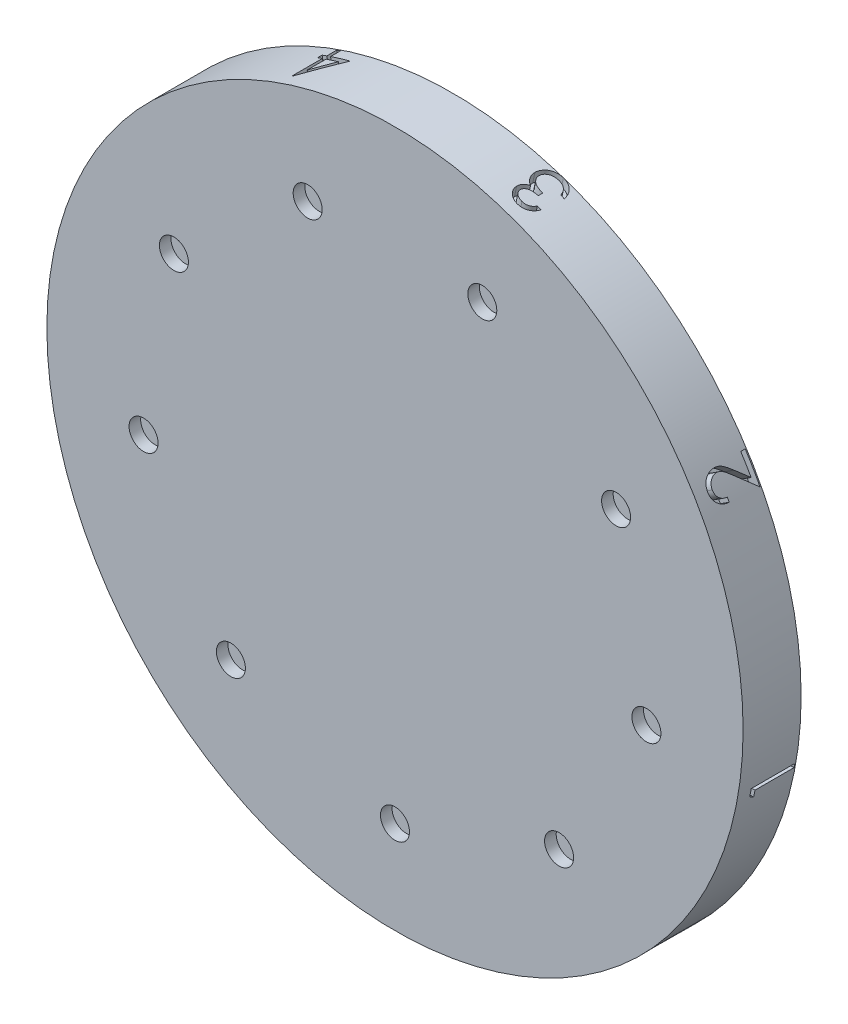
from build123d import *

# Parameters (mm, degrees)
SKETCH1_R           = 76.2
BOSS_EXTRUDE1_DEPTH = 12.7
SKETCH2_R           = 3.175
CUT_EXTRUDE2_DEPTH  = 2.54
SKETCH4_R           = 6.35
CUT_EXTRUDE4_DEPTH  = 5.08
CUT_EXTRUDE5_DEPTH  = 2.54
CUT_EXTRUDE6_DEPTH  = 2.54
CUT_EXTRUDE7_DEPTH  = 2.54
CUT_EXTRUDE8_DEPTH  = 2.54
CUT_EXTRUDE9_DEPTH  = 2.54
CUT_EXTRUDE10_DEPTH = 2.54
CUT_EXTRUDE11_DEPTH = 2.54
CUT_EXTRUDE12_DEPTH = 2.54
CUT_EXTRUDE13_DEPTH = 2.54


with BuildPart() as part:
    # Sketch1 → Boss-Extrude1 (new body)
    with BuildSketch(Plane.XY):
        Circle(SKETCH1_R)
    extrude(amount=BOSS_EXTRUDE1_DEPTH)

    # Sketch2 → Cut-Extrude2 (cut)
    with BuildSketch(Plane.XY.offset(12.7)):
        with Locations((0, -55.88)):
            Circle(SKETCH2_R)
        with Locations((-35.918971629, -42.806563481)):
            Circle(SKETCH2_R)
        with Locations((-55.031057238, -9.703460168)):
            Circle(SKETCH2_R)
        with Locations((-48.393499563, 27.94)):
            Circle(SKETCH2_R)
        with Locations((-19.112085609, 52.51002365)):
            Circle(SKETCH2_R)
        with Locations((19.112085609, 52.51002365)):
            Circle(SKETCH2_R)
        with Locations((48.393499563, 27.94)):
            Circle(SKETCH2_R)
        with Locations((55.031057238, -9.703460168)):
            Circle(SKETCH2_R)
        with Locations((35.918971629, -42.806563481)):
            Circle(SKETCH2_R)
    extrude(amount=-CUT_EXTRUDE2_DEPTH, mode=Mode.SUBTRACT)

    # Sketch4 → Cut-Extrude4 (cut)
    with BuildSketch(Plane(origin=(0, 0, 0), x_dir=(-1, 0, 0), z_dir=(0, 0, -1))):
        Circle(SKETCH4_R)
    extrude(amount=-CUT_EXTRUDE4_DEPTH, mode=Mode.SUBTRACT)

    # Sketch5 → Cut-Extrude5 (cut)
    with BuildSketch(Plane(origin=(76.2, 0, 0), x_dir=(0, 0, -1), z_dir=(1, 0, 0))):
        Polygon((-9.779, -14.958355629), (-9.779, -13.197222817), (-0.254, -13.197222817), (-0.254, -14.052030509), (-8.802076923, -14.052030509), (-8.802076923, -15.517415125), align=None)
    extrude(amount=-CUT_EXTRUDE5_DEPTH, mode=Mode.SUBTRACT)

    # Sketch9 → Cut-Extrude6 (cut)
    with BuildSketch(Plane(origin=(64.070307616, 41.248462783, 0), x_dir=(0.5413184092295229, -0.8408176852500302, 0), z_dir=(0.8408176852500302, 0.5413184092295229, 0))):
        with BuildLine():
            Line((5.512499921, -6.848230769), (6.367307613, -6.848230769))
            add(Edge.make_bspline(
                [(6.367307613, -6.848230769), (6.361737381, -6.961635673), (6.350797593, -7.184359885), (6.29954433, -7.509083464), (6.226275221, -7.819504079), (6.122435799, -8.112960447), (5.994203188, -8.392958148), (5.837209363, -8.655779138), (5.654801178, -8.904031883), (5.447313268, -9.133016136), (5.222169763, -9.342336373), (4.980719623, -9.525007952), (4.725444498, -9.677581719), (4.458558535, -9.805823488), (4.17697512, -9.901967628), (3.883385876, -9.973336337), (3.576463808, -10.016268246), (3.367349412, -10.020883522), (3.260997517, -10.023230769)],
                knots=[0, 0, 0, 0, 1.100776268, 2.161895295, 3.184016182, 4.190939212, 5.176500551, 6.166955529, 7.155448256, 8.160289653, 9.16017456, 10.133824356, 11.091467644, 12.04088621, 13.000931625, 13.972173743, 14.968683325, 16, 16, 16, 16], degree=3))
            add(Edge.make_bspline(
                [(3.260997517, -10.023230769), (3.15654698, -10.020805526), (2.951305405, -10.01604001), (2.651883472, -9.974499656), (2.366163138, -9.910842765), (2.097382469, -9.81651328), (1.842783018, -9.698150411), (1.605517151, -9.550950676), (1.379847531, -9.381879071), (1.176849629, -9.182450822), (0.990371568, -8.969660377), (0.829638753, -8.742401971), (0.691214389, -8.507409781), (0.57791837, -8.262848177), (0.49203495, -8.007920747), (0.428403566, -7.745071568), (0.392028428, -7.471267183), (0.386476437, -7.285914725), (0.383653767, -7.191680288)],
                knots=[0, 0, 0, 0, 1.111674182, 2.184400057, 3.212814286, 4.223731311, 5.211378316, 6.196328225, 7.191884489, 8.207283132, 9.220262353, 10.201199469, 11.166417575, 12.120932471, 13.06540007, 14.026332106, 14.996573967, 16, 16, 16, 16], degree=3))
            add(Edge.make_bspline(
                [(0.383653767, -7.191680288), (0.388261934, -7.059016596), (0.397397399, -6.79601727), (0.475540463, -6.409533128), (0.597591079, -6.035085653), (0.744528006, -5.733711723), (0.89280002, -5.490892134), (1.026280993, -5.290867771), (1.183431222, -5.075551985), (1.362908086, -4.844073288), (1.567802431, -4.599463088), (1.792791129, -4.336730681), (2.043684591, -4.060734169), (2.219621225, -3.872102024), (2.310787181, -3.774357572)],
                knots=[0, 0, 0, 0, 1.184416499, 2.348048165, 3.509039915, 4.696071444, 5.333504901, 6.05069495, 6.844171097, 7.714965912, 8.667477798, 9.695072654, 10.805644396, 12, 12, 12, 12], degree=3))
            Line((2.310787181, -3.774357572), (4.693945234, -1.230923077))
            Line((4.693945234, -1.230923077), (0.261538383, -1.230923077))
            Line((0.261538383, -1.230923077), (0.261538383, -0.254))
            Line((0.261538383, -0.254), (6.733653767, -0.254))
            Line((6.733653767, -0.254), (3.039663383, -4.19603726))
            add(Edge.make_bspline(
                [(3.039663383, -4.19603726), (2.949719552, -4.289916816), (2.77695586, -4.470240231), (2.532702764, -4.733586657), (2.31297133, -4.977609906), (2.117615799, -5.203391305), (1.946475432, -5.409650884), (1.800097804, -5.598005051), (1.67783595, -5.766837404), (1.548263863, -5.965174594), (1.424708281, -6.207619944), (1.316115566, -6.502410515), (1.250375013, -6.806545379), (1.242448542, -7.012008475), (1.238461459, -7.115358173)],
                knots=[0, 0, 0, 0, 1.329530082, 2.553755191, 3.672934919, 4.687409497, 5.60679272, 6.413407421, 7.126401618, 7.737995624, 8.834647426, 9.90044882, 10.943907757, 12, 12, 12, 12], degree=3))
            add(Edge.make_bspline(
                [(1.238461459, -7.115358173), (1.240173815, -7.180356875), (1.243548539, -7.308456835), (1.273896266, -7.496148032), (1.318483101, -7.677900083), (1.387205188, -7.851465755), (1.469772244, -8.020258747), (1.575257748, -8.179147228), (1.695799977, -8.333547323), (1.835623052, -8.478164782), (1.989122806, -8.610656831), (2.151309567, -8.728013435), (2.322894548, -8.826091957), (2.503162677, -8.906492299), (2.691609176, -8.969562491), (2.888599116, -9.013264755), (3.093588039, -9.040703519), (3.233560625, -9.044416014), (3.304882734, -9.046307692)],
                knots=[0, 0, 0, 0, 0.991504627, 1.954065223, 2.895985987, 3.842598665, 4.797835564, 5.759220273, 6.74786863, 7.784730864, 8.824135544, 9.839918996, 10.835834653, 11.835434876, 12.84861661, 13.863796685, 14.911511676, 16, 16, 16, 16], degree=3))
            add(Edge.make_bspline(
                [(3.304882734, -9.046307692), (3.379389527, -9.044439156), (3.525708567, -9.040769659), (3.740075671, -9.012957907), (3.946006227, -8.970838427), (4.140326902, -8.903784559), (4.327104482, -8.825306767), (4.501574178, -8.723691831), (4.668637061, -8.607581052), (4.824934281, -8.472203259), (4.967287275, -8.319382121), (5.096787068, -8.153039013), (5.206513526, -7.970225009), (5.303916596, -7.775326783), (5.378410714, -7.562989677), (5.442097847, -7.338406654), (5.488359256, -7.098373441), (5.504319382, -6.932996532), (5.512499921, -6.848230769)],
                knots=[0, 0, 0, 0, 1.031072318, 2.024855787, 2.988461151, 3.935103592, 4.865765533, 5.788564469, 6.724086513, 7.67908574, 8.64457978, 9.611397706, 10.591395687, 11.591555111, 12.622101007, 13.700900657, 14.821571223, 16, 16, 16, 16], degree=3))
        make_face()
    extrude(amount=-CUT_EXTRUDE6_DEPTH, mode=Mode.SUBTRACT)

    # Sketch11 → Cut-Extrude7 (cut)
    with BuildSketch(Plane(origin=(15.81073851, 74.541669875, 0), x_dir=(0.9782371374688645, -0.2074900066912188, 0), z_dir=(0.2074900066912188, 0.9782371374688645, 0))):
        with BuildLine():
            Line((10.609500605, -7.580923077), (11.464308297, -7.580923077))
            add(Edge.make_bspline(
                [(11.464308297, -7.580923077), (11.441150163, -7.676805765), (11.395877904, -7.864248579), (11.301450937, -8.13205691), (11.198582964, -8.385485922), (11.075059758, -8.619790237), (10.940325219, -8.839678679), (10.785958384, -9.04016394), (10.619081139, -9.226344938), (10.434500384, -9.391571678), (10.240928812, -9.541189641), (10.035638883, -9.668756761), (9.822760865, -9.778496063), (9.600819839, -9.868902551), (9.369155043, -9.937007726), (9.129860854, -9.986420176), (8.882310186, -10.018508851), (8.714268529, -10.02164057), (8.628941711, -10.023230769)],
                knots=[0, 0, 0, 0, 1.162005537, 2.271625781, 3.343758855, 4.383309926, 5.390229558, 6.379919256, 7.361854164, 8.333198761, 9.295911338, 10.242430842, 11.177959212, 12.116337295, 13.062827104, 14.020064771, 14.994644689, 16, 16, 16, 16], degree=3))
            add(Edge.make_bspline(
                [(8.628941711, -10.023230769), (8.504619391, -10.019477293), (8.258686583, -10.012052214), (7.897381434, -9.944249354), (7.54896559, -9.836956673), (7.217252709, -9.688710315), (6.909136831, -9.505864842), (6.634990495, -9.288246522), (6.398529619, -9.040054137), (6.200152777, -8.765917659), (6.044827244, -8.472940879), (5.930292184, -8.171406166), (5.86056461, -7.862028801), (5.851527951, -7.653139349), (5.847000605, -7.548486178)],
                knots=[0, 0, 0, 0, 1.083050992, 2.142477498, 3.193116406, 4.255571735, 5.30263384, 6.308962982, 7.297363603, 8.282367274, 9.249857812, 10.179914175, 11.08814088, 12, 12, 12, 12], degree=3))
            add(Edge.make_bspline(
                [(5.847000605, -7.548486178), (5.850167235, -7.447774829), (5.856363838, -7.250698349), (5.908979137, -6.962984846), (5.997524252, -6.691817348), (6.120178392, -6.436054328), (6.278950754, -6.197317443), (6.47128145, -5.975069554), (6.69852798, -5.768324917), (6.87073709, -5.64988978), (6.959395437, -5.588915865)],
                knots=[0, 0, 0, 0, 1.024540389, 2.004866551, 2.965041327, 3.920577974, 4.882998113, 5.874504559, 6.905732034, 8, 8, 8, 8], degree=3))
            add(Edge.make_bspline(
                [(6.959395437, -5.588915865), (6.857942726, -5.540166922), (6.656609801, -5.443424636), (6.38495293, -5.250683649), (6.134585621, -5.033609458), (5.99660162, -4.862316338), (5.927138826, -4.776085337)],
                knots=[0, 0, 0, 0, 1.015663554, 2.015584519, 3.001021554, 4, 4, 4, 4], degree=3))
            add(Edge.make_bspline(
                [(5.927138826, -4.776085337), (5.881287659, -4.713342), (5.79033617, -4.588882792), (5.678389171, -4.388660964), (5.575670254, -4.186882734), (5.500072105, -3.975614442), (5.434833897, -3.761642399), (5.391909329, -3.54038461), (5.364353473, -3.31394321), (5.360484068, -3.160681319), (5.358539067, -3.083642428)],
                knots=[0, 0, 0, 0, 1.02516404, 2.033540309, 3.025129118, 4.011046665, 4.991655828, 5.976607087, 6.982917762, 8, 8, 8, 8], degree=3))
            add(Edge.make_bspline(
                [(5.358539067, -3.083642428), (5.363434162, -2.95027196), (5.373201318, -2.684158667), (5.460126288, -2.290891224), (5.595718248, -1.907180519), (5.784688122, -1.538468299), (6.019549068, -1.194541613), (6.297421517, -0.885934972), (6.618601341, -0.62308512), (6.973737174, -0.401519065), (7.359979906, -0.225930465), (7.771455404, -0.099404647), (8.205727447, -0.023506903), (8.502706458, -0.014400591), (8.653746398, -0.009769231)],
                knots=[0, 0, 0, 0, 0.955619592, 1.906742024, 2.874954321, 3.868585453, 4.869520953, 5.854611167, 6.836527075, 7.836578462, 8.849204403, 9.870874567, 10.917152508, 12, 12, 12, 12], degree=3))
            add(Edge.make_bspline(
                [(8.653746398, -0.009769231), (8.755573941, -0.01215262), (8.95593659, -0.016842334), (9.250604829, -0.048331314), (9.531283404, -0.107406942), (9.800697814, -0.18170272), (10.054781942, -0.284424958), (10.29719055, -0.406888895), (10.526861077, -0.552234958), (10.742429586, -0.720707578), (10.943665767, -0.909287483), (11.125442791, -1.121107512), (11.289771827, -1.352214371), (11.435608749, -1.604686902), (11.563567327, -1.877817966), (11.670893884, -2.172702049), (11.764603225, -2.48705308), (11.808256923, -2.706057732), (11.830654451, -2.818423077)],
                knots=[0, 0, 0, 0, 1.048603596, 2.063302207, 3.045874044, 3.999447474, 4.937100059, 5.862643889, 6.7929026, 7.7308982, 8.676022965, 9.627908155, 10.600123445, 11.591992905, 12.626222643, 13.701663232, 14.820785756, 16, 16, 16, 16], degree=3))
            Line((11.830654451, -2.818423077), (10.975846759, -2.818423077))
            add(Edge.make_bspline(
                [(10.975846759, -2.818423077), (10.953576516, -2.745083262), (10.910258958, -2.602430952), (10.836523762, -2.397125549), (10.752517964, -2.208916847), (10.662399058, -2.036424208), (10.567752001, -1.877948884), (10.461847812, -1.737681369), (10.352530353, -1.609460712), (10.270127256, -1.537221446), (10.229798081, -1.501866587)],
                knots=[0, 0, 0, 0, 1.198163088, 2.33053128, 3.407730985, 4.417276592, 5.372219308, 6.28897303, 7.162600585, 8, 8, 8, 8], degree=3))
            add(Edge.make_bspline(
                [(10.229798081, -1.501866587), (10.176461441, -1.460767289), (10.069952799, -1.378695559), (9.896501511, -1.273661678), (9.713445657, -1.183755188), (9.519258679, -1.110675425), (9.31391453, -1.055819119), (9.098246171, -1.016336131), (8.871899744, -0.990271224), (8.71742273, -0.98790268), (8.638481975, -0.986692308)],
                knots=[0, 0, 0, 0, 0.946083416, 1.889246487, 2.84504177, 3.809995578, 4.801312957, 5.829064617, 6.89060985, 8, 8, 8, 8], degree=3))
            add(Edge.make_bspline(
                [(8.638481975, -0.986692308), (8.549344451, -0.988365724), (8.375043716, -0.991637945), (8.12072985, -1.021817774), (7.87871435, -1.065579467), (7.651466985, -1.134031262), (7.435895476, -1.2161505), (7.236812001, -1.323659653), (7.048363753, -1.44507386), (6.876071394, -1.586301935), (6.720741407, -1.738954197), (6.586519137, -1.900904643), (6.470267301, -2.067131756), (6.376820224, -2.241513277), (6.302899201, -2.422338664), (6.252607231, -2.610284748), (6.217630423, -2.803768906), (6.214782458, -2.93529301), (6.213346759, -3.001596154)],
                knots=[0, 0, 0, 0, 1.216990249, 2.379719373, 3.493992396, 4.571561497, 5.616923107, 6.638958652, 7.655775068, 8.674704564, 9.676001865, 10.625896028, 11.54399481, 12.441854662, 13.322657739, 14.20572845, 15.095482574, 16, 16, 16, 16], degree=3))
            add(Edge.make_bspline(
                [(6.213346759, -3.001596154), (6.217520055, -3.090340007), (6.225845881, -3.267386137), (6.28914836, -3.527958197), (6.394203104, -3.779115408), (6.538415632, -4.017568652), (6.718174043, -4.235983225), (6.924981167, -4.431487812), (7.163249617, -4.594275463), (7.383793299, -4.706434024), (7.579651533, -4.781160843), (7.746924402, -4.833561612), (7.934358856, -4.87544883), (8.139702727, -4.915966748), (8.363822685, -4.949934299), (8.606920456, -4.978383485), (8.869093898, -5.001111535), (9.050588777, -5.01126682), (9.14411599, -5.0165)],
                knots=[0, 0, 0, 0, 1.070440979, 2.135555593, 3.216243406, 4.345886539, 5.486149072, 6.621334998, 7.769144672, 8.957074012, 9.598644492, 10.297969361, 11.070758978, 11.915404831, 12.824182859, 13.805940418, 14.869366021, 16, 16, 16, 16], degree=3))
            Line((9.14411599, -5.0165), (9.14411599, -5.993423077))
            add(Edge.make_bspline(
                [(9.14411599, -5.993423077), (9.026320792, -5.995719696), (8.795669621, -6.000216634), (8.457800127, -6.043405953), (8.135704915, -6.11350832), (7.834228773, -6.211380331), (7.560865373, -6.330531768), (7.321437828, -6.463935861), (7.124559594, -6.617838662), (6.966704566, -6.784964973), (6.849621777, -6.965350035), (6.763198178, -7.152504079), (6.712080441, -7.349908817), (6.705244402, -7.484600242), (6.701808297, -7.552302284)],
                knots=[0, 0, 0, 0, 1.321816535, 2.58820849, 3.816448615, 5.017641336, 6.139869627, 7.160068286, 8.085608132, 8.934319198, 9.728416342, 10.48890201, 11.240453369, 12, 12, 12, 12], degree=3))
            add(Edge.make_bspline(
                [(6.701808297, -7.552302284), (6.702911274, -7.602052258), (6.705105594, -7.701027472), (6.733884031, -7.846079604), (6.775130939, -7.986699434), (6.835054341, -8.121243912), (6.912553514, -8.250140743), (7.006315978, -8.373860701), (7.116579241, -8.493585202), (7.242627276, -8.606673726), (7.383300111, -8.708455399), (7.532951689, -8.799192343), (7.692165441, -8.875489196), (7.859903814, -8.938734105), (8.037073515, -8.986225759), (8.222742493, -9.020347474), (8.417292433, -9.041675333), (8.550021035, -9.04474648), (8.617493393, -9.046307692)],
                knots=[0, 0, 0, 0, 0.884246871, 1.759167212, 2.622361933, 3.489113179, 4.372562419, 5.294145153, 6.247651513, 7.265905295, 8.30305477, 9.334068495, 10.37719476, 11.441246459, 12.52060732, 13.637552802, 14.799054011, 16, 16, 16, 16], degree=3))
            add(Edge.make_bspline(
                [(8.617493393, -9.046307692), (8.725950445, -9.042528545), (8.937792293, -9.035146991), (9.24312724, -8.970266457), (9.526684388, -8.86746994), (9.742697736, -8.74334345), (9.902480276, -8.621236237), (10.018848484, -8.516187402), (10.131039356, -8.397083538), (10.234650422, -8.260657762), (10.335890275, -8.111601204), (10.433792227, -7.949092915), (10.525211664, -7.770816013), (10.580860173, -7.645446557), (10.609500605, -7.580923077)],
                knots=[0, 0, 0, 0, 1.4727372, 2.876598283, 4.222346151, 5.558423782, 6.24313385, 6.953189256, 7.68715613, 8.463578749, 9.278833271, 10.135787152, 11.040551781, 12, 12, 12, 12], degree=3))
        make_face()
    extrude(amount=-CUT_EXTRUDE7_DEPTH, mode=Mode.SUBTRACT)

    # Sketch12 → Cut-Extrude8 (cut)
    with BuildSketch(Plane(origin=(-17.855163532, 74.078560564, 0), x_dir=(0.9721595874542194, 0.23431973139460982, 0), z_dir=(-0.23431973139460982, 0.9721595874542194, 0))):
        Polygon((-7.445499042, -10.023230769), (-7.619131855, -10.023230769), (-7.619131855, -3.429), (-8.718170316, -3.429), (-8.718170316, -2.452076923), (-7.619131855, -2.452076923), (-7.619131855, -0.254), (-6.764324162, -0.254), (-6.764324162, -2.452076923), (-2.246054932, -2.452076923), align=None)
        Polygon((-6.764324162, -3.429), (-6.764324162, -7.565658654), (-3.92514147, -3.429), align=None, mode=Mode.SUBTRACT)
    extrude(amount=-CUT_EXTRUDE8_DEPTH, mode=Mode.SUBTRACT)

    # Sketch13 → Cut-Extrude9 (cut)
    with BuildSketch(Plane(origin=(-64.683686355, 40.27978053, 0), x_dir=(0, 0, 1), z_dir=(-0.8488672750013438, 0.5286060436958632, 0))):
        with BuildLine():
            Line((9.779, -3.817590835), (8.802076923, -3.817590835))
            Line((8.802076923, -3.817590835), (8.802076923, -0.577717037))
            Line((8.802076923, -0.577717037), (6.296803486, -0.064450811))
            add(Edge.make_bspline(
                [(6.296803486, -0.064450811), (6.32464444, -0.165295726), (6.378581885, -0.3606668), (6.438469017, -0.649028993), (6.474569975, -0.92278349), (6.479499328, -1.100425748), (6.481884615, -1.186385907)],
                knots=[0, 0, 0, 0, 1.100273476, 2.13160584, 3.095893838, 4, 4, 4, 4], degree=3))
            add(Edge.make_bspline(
                [(6.481884615, -1.186385907), (6.479581859, -1.292749146), (6.475054065, -1.501885849), (6.431596381, -1.807885627), (6.363148804, -2.099965488), (6.267683672, -2.3776264), (6.144821321, -2.641466416), (5.993334612, -2.890012131), (5.814271366, -3.124672144), (5.609359238, -3.342344342), (5.383559687, -3.539510271), (5.141573105, -3.713549252), (4.883179382, -3.858293517), (4.609521117, -3.977376796), (4.321057475, -4.071857878), (4.015653255, -4.134914974), (3.696018639, -4.176856455), (3.477476592, -4.181545751), (3.366034255, -4.183936989)],
                knots=[0, 0, 0, 0, 1.052772836, 2.070014431, 3.053871312, 4.019926262, 4.972333346, 5.930471369, 6.896690565, 7.89035727, 8.885779078, 9.861050232, 10.836829716, 11.812751485, 12.812646763, 13.836748493, 14.896881366, 16, 16, 16, 16], degree=3))
            add(Edge.make_bspline(
                [(3.366034255, -4.183936989), (3.288412968, -4.182127278), (3.134219378, -4.178532312), (2.905228439, -4.160244582), (2.681078318, -4.125054251), (2.461772374, -4.077740163), (2.247603798, -4.016573348), (2.038650495, -3.941722351), (1.83426906, -3.853491479), (1.634446106, -3.753876732), (1.445341857, -3.638640933), (1.264037207, -3.517253467), (1.097204545, -3.382789566), (0.938753371, -3.241759306), (0.794906308, -3.088523466), (0.659507519, -2.927838242), (0.53843845, -2.755932752), (0.427082237, -2.575884743), (0.32737821, -2.387807753), (0.244207242, -2.189794719), (0.17130717, -1.986192545), (0.112024445, -1.775186545), (0.066029619, -1.557185503), (0.034707766, -1.331438716), (0.011918393, -1.09907894), (0.010490504, -0.941576553), (0.009769231, -0.862016917)],
                knots=[0, 0, 0, 0, 1.05623316, 2.098192244, 3.122504159, 4.140841222, 5.148757784, 6.150489607, 7.158294732, 8.176043417, 9.185147859, 10.169157858, 11.142149047, 12.097904048, 13.0527185, 13.998867679, 14.954465986, 15.910220987, 16.877849176, 17.847023716, 18.829548819, 19.818454515, 20.826519638, 21.858115382, 22.918063636, 24, 24, 24, 24], degree=3))
            add(Edge.make_bspline(
                [(0.009769231, -0.862016917), (0.011649462, -0.767109441), (0.015348594, -0.580390195), (0.054040838, -0.306828995), (0.109468356, -0.043633152), (0.192811537, 0.207114373), (0.297395096, 0.44752914), (0.428733768, 0.67441077), (0.57964788, 0.892218727), (0.755344475, 1.095033245), (0.949183551, 1.282887647), (1.157281531, 1.45363098), (1.380465847, 1.603371861), (1.616836451, 1.73272137), (1.866800059, 1.842895266), (2.131104651, 1.929488125), (2.408420622, 1.999367018), (2.59933806, 2.028931442), (2.696307692, 2.043947626)],
                knots=[0, 0, 0, 0, 1.046825758, 2.059506013, 3.044032586, 4.011925612, 4.970610144, 5.93275819, 6.900651216, 7.891265644, 8.889116719, 9.876966323, 10.858259055, 11.851035124, 12.847502422, 13.86866322, 14.9174643, 16, 16, 16, 16], degree=3))
            Line((2.696307692, 2.043947626), (2.696307692, 1.189139934))
            add(Edge.make_bspline(
                [(2.696307692, 1.189139934), (2.605467395, 1.168120454), (2.430867299, 1.127719847), (2.185696619, 1.038809476), (1.966393864, 0.93077032), (1.772751998, 0.799377438), (1.603004274, 0.645811046), (1.450428786, 0.471833517), (1.314604357, 0.274966314), (1.200659296, 0.056287435), (1.10362428, -0.174554261), (1.038976435, -0.416120173), (0.993528579, -0.661879016), (0.988978675, -0.828099167), (0.986692308, -0.911626292)],
                knots=[0, 0, 0, 0, 1.136389429, 2.184203582, 3.172920998, 4.111012962, 5.028380909, 5.957351669, 6.927793475, 7.937618031, 8.960409703, 9.974842029, 10.982339866, 12, 12, 12, 12], degree=3))
            add(Edge.make_bspline(
                [(0.986692308, -0.911626292), (0.988925996, -0.993156058), (0.993324147, -1.153688836), (1.02717603, -1.389939824), (1.079311992, -1.618030575), (1.157334954, -1.835710453), (1.252162367, -2.046788643), (1.373851251, -2.245925832), (1.513896016, -2.438882948), (1.674342273, -2.619662368), (1.851152657, -2.785232584), (2.04023042, -2.931526028), (2.241934124, -3.053383199), (2.452771776, -3.156073881), (2.675054135, -3.234051787), (2.907739476, -3.289680458), (3.151402529, -3.322345925), (3.317598294, -3.326839493), (3.40228726, -3.329129297)],
                knots=[0, 0, 0, 0, 1.027316725, 2.022795036, 3.002884548, 3.971462791, 4.93288096, 5.914575861, 6.907176829, 7.935150275, 8.956128384, 9.956726525, 10.942570165, 11.921478529, 12.907843606, 13.90538589, 14.932640048, 16, 16, 16, 16], degree=3))
            add(Edge.make_bspline(
                [(3.40228726, -3.329129297), (3.478739451, -3.327625925), (3.628469496, -3.324681604), (3.846562517, -3.291962962), (4.054417867, -3.246129222), (4.250176762, -3.175757362), (4.436705807, -3.088806956), (4.610012602, -2.978493618), (4.774549695, -2.852394109), (4.923632839, -2.704696707), (5.062158344, -2.543638967), (5.180074435, -2.365482196), (5.279319644, -2.174290013), (5.364954443, -1.972275265), (5.426461626, -1.754657676), (5.472638269, -1.525739939), (5.499350146, -1.283051991), (5.503056418, -1.117124605), (5.504961538, -1.031833624)],
                knots=[0, 0, 0, 0, 1.045726679, 2.048034203, 3.01323695, 3.95502507, 4.889743367, 5.8246644, 6.761650845, 7.722168973, 8.692072792, 9.66525385, 10.638902184, 11.638179751, 12.663148338, 13.728659964, 14.832472288, 16, 16, 16, 16], degree=3))
            add(Edge.make_bspline(
                [(5.504961538, -1.031833624), (5.503435155, -0.957363029), (5.500310412, -0.804910161), (5.475719329, -0.570514137), (5.437888315, -0.325270968), (5.38336175, -0.068228542), (5.315090737, 0.199907732), (5.229828801, 0.479583768), (5.131617804, 0.770806324), (5.055442008, 0.966819958), (5.0165, 1.067024549)],
                knots=[0, 0, 0, 0, 0.824638674, 1.688163388, 2.607705698, 3.571998603, 4.597075385, 5.671199175, 6.809488238, 8, 8, 8, 8], degree=3))
            Line((5.0165, 1.067024549), (9.779, 0.090101473))
            Line((9.779, 0.090101473), (9.779, -3.817590835))
        make_face()
    extrude(amount=-CUT_EXTRUDE9_DEPTH, mode=Mode.SUBTRACT)

    # Sketch14 → Cut-Extrude10 (cut)
    with BuildSketch(Plane(origin=(-75.524562375, -10.123264203, 0), x_dir=(0, 0, 1), z_dir=(-0.9911359891689351, -0.13285123625362558, 0))):
        with BuildLine():
            Line((10.023230769, -6.336312298), (9.506148438, -6.994590543))
            Line((9.506148438, -6.994590543), (5.657605769, -4.477868788))
            add(Edge.make_bspline(
                [(5.657605769, -4.477868788), (5.68431349, -4.645427899), (5.736409919, -4.97227089), (5.745004042, -5.3031038), (5.749192308, -5.46433213)],
                knots=[0, 0, 0, 0, 1.025318673, 2, 2, 2, 2], degree=3))
            add(Edge.make_bspline(
                [(5.749192308, -5.46433213), (5.746590318, -5.561140137), (5.741468379, -5.75170382), (5.702051614, -6.031485189), (5.639934702, -6.300332222), (5.549386634, -6.557130609), (5.433719512, -6.802802082), (5.295093015, -7.038756459), (5.126348985, -7.260558358), (4.937849356, -7.471064068), (4.729069562, -7.662182097), (4.507541639, -7.831389791), (4.273496384, -7.973521274), (4.027052342, -8.088838875), (3.7685894, -8.178387152), (3.498438249, -8.243667814), (3.216412601, -8.282256564), (3.024611281, -8.287496649), (2.927182091, -8.290158452)],
                knots=[0, 0, 0, 0, 1.04369286, 2.054478336, 3.041073146, 4.015093852, 4.984733326, 5.965804835, 6.960378782, 7.985147595, 9.009457201, 10.008161701, 10.986880575, 11.956520048, 12.937015923, 13.931873656, 14.949455224, 16, 16, 16, 16], degree=3))
            add(Edge.make_bspline(
                [(2.927182091, -8.290158452), (2.793966563, -8.285187684), (2.531984494, -8.275412158), (2.148814387, -8.204250478), (1.786706302, -8.081441317), (1.444237215, -7.917137387), (1.131371283, -7.703965957), (0.848624376, -7.451346092), (0.60216891, -7.156889829), (0.390745032, -6.827569956), (0.222769027, -6.471143581), (0.098580938, -6.097418868), (0.024375399, -5.709590214), (0.014660348, -5.446201196), (0.009769231, -5.313595952)],
                knots=[0, 0, 0, 0, 1.031881447, 2.029301251, 3.006342947, 3.987068354, 4.962916383, 5.929513747, 6.915671209, 7.928552063, 8.953527267, 9.960179832, 10.973036711, 12, 12, 12, 12], degree=3))
            add(Edge.make_bspline(
                [(0.009769231, -5.313595952), (0.013928123, -5.18542562), (0.02216616, -4.931542634), (0.095552188, -4.558073749), (0.214497365, -4.199216597), (0.378368411, -3.857493648), (0.585346366, -3.540916246), (0.834556582, -3.257779694), (1.120491229, -3.009069083), (1.444027449, -2.8031807), (1.789449296, -2.635381109), (2.152908112, -2.517029632), (2.527089143, -2.440491422), (2.781798558, -2.432594833), (2.910009615, -2.42861999)],
                knots=[0, 0, 0, 0, 1.011913813, 2.004424092, 2.994488568, 3.992479987, 4.990471406, 5.973328987, 6.963763268, 7.974390938, 8.994854117, 9.989689954, 10.988086187, 12, 12, 12, 12], degree=3))
            add(Edge.make_bspline(
                [(2.910009615, -2.42861999), (3.008066658, -2.432071982), (3.208191309, -2.439117152), (3.51216247, -2.481161918), (3.821971433, -2.558277156), (4.084604675, -2.641732697), (4.302112583, -2.724545787), (4.473872832, -2.801331989), (4.65525717, -2.887188319), (4.842833627, -2.987823895), (5.041961668, -3.094505726), (5.245266975, -3.219122211), (5.460174884, -3.349161429), (5.603257232, -3.444424844), (5.676686298, -3.4933135)],
                knots=[0, 0, 0, 0, 1.17367173, 2.395347028, 3.66355231, 4.98980831, 5.690886799, 6.447442954, 7.240630024, 8.091733897, 8.994365608, 9.943299771, 10.944512865, 12, 12, 12, 12], degree=3))
            Line((5.676686298, -3.4933135), (10.023230769, -6.336312298))
        make_face()
        with BuildLine():
            add(Edge.make_bspline(
                [(4.772269231, -5.284975158), (4.770123791, -5.21241804), (4.765914457, -5.070061572), (4.742140107, -4.861467525), (4.697094232, -4.664579846), (4.638826355, -4.477149757), (4.559490564, -4.301130771), (4.464265123, -4.134515034), (4.351048297, -3.978955859), (4.221102429, -3.837185133), (4.080908689, -3.707004593), (3.929849023, -3.59502807), (3.772538568, -3.498331787), (3.607498797, -3.419738468), (3.434835576, -3.358531591), (3.255331675, -3.314259182), (3.067786452, -3.289619917), (2.940607265, -3.285520833), (2.875664663, -3.283427682)],
                knots=[0, 0, 0, 0, 1.129474985, 2.216020618, 3.260639938, 4.268601163, 5.26556745, 6.258792394, 7.250684778, 8.252748164, 9.247500881, 10.223461414, 11.174097059, 12.117127289, 13.062595836, 14.020469732, 14.98917545, 16, 16, 16, 16], degree=3))
            add(Edge.make_bspline(
                [(2.875664663, -3.283427682), (2.811305382, -3.285136673), (2.685106413, -3.288487748), (2.499091257, -3.318775313), (2.320247887, -3.365370163), (2.148445496, -3.433572677), (1.984621238, -3.519118572), (1.827611423, -3.624392228), (1.677307678, -3.747611108), (1.537500131, -3.890850612), (1.409265252, -4.045320529), (1.295084674, -4.208682698), (1.199203521, -4.38041769), (1.123401912, -4.561505442), (1.061318587, -4.749410583), (1.017599795, -4.945566579), (0.992890125, -5.150145781), (0.988785362, -5.288725971), (0.986692308, -5.359389221)],
                knots=[0, 0, 0, 0, 0.989642335, 1.94054129, 2.892446913, 3.828371744, 4.778262963, 5.730973156, 6.732161388, 7.763274768, 8.805796303, 9.818398792, 10.825975928, 11.825728216, 12.834635236, 13.867465554, 14.912602056, 16, 16, 16, 16], degree=3))
            add(Edge.make_bspline(
                [(0.986692308, -5.359389221), (0.988785198, -5.430052586), (0.992889639, -5.568633003), (1.017601642, -5.77321056), (1.061311811, -5.969372639), (1.123426477, -6.15725567), (1.199112393, -6.33842504), (1.295685479, -6.510310359), (1.408571026, -6.675232203), (1.537720839, -6.829600784), (1.6765177, -6.973438989), (1.82897232, -7.093771813), (1.983373347, -7.202371302), (2.149098326, -7.284631619), (2.320144463, -7.353593697), (2.499118964, -7.399953456), (2.68509916, -7.430303698), (2.811302932, -7.433646161), (2.875664663, -7.435350759)],
                knots=[0, 0, 0, 0, 1.087205562, 2.132157158, 3.164804748, 4.173533273, 5.173108684, 6.180507559, 7.20098426, 8.243321352, 9.274252308, 10.269075238, 11.227079059, 12.172305571, 13.108064818, 14.05980203, 15.010532752, 16, 16, 16, 16], degree=3))
            add(Edge.make_bspline(
                [(2.875664663, -7.435350759), (2.940699525, -7.433870631), (3.068341807, -7.430965621), (3.255162704, -7.39747207), (3.436295239, -7.352233454), (3.607659111, -7.279123705), (3.77399322, -7.192044026), (3.930543612, -7.081110235), (4.081745389, -6.953921929), (4.222032216, -6.806625529), (4.350349966, -6.646380232), (4.463611884, -6.475971036), (4.559202718, -6.297697174), (4.638959712, -6.111730854), (4.696516547, -5.91594354), (4.741837144, -5.713495518), (4.765954496, -5.501797658), (4.770137509, -5.358169887), (4.772269231, -5.284975158)],
                knots=[0, 0, 0, 0, 0.978265087, 1.920016216, 2.851775529, 3.783928695, 4.718195979, 5.674835085, 6.667117013, 7.690134047, 8.732874136, 9.755756613, 10.767227014, 11.776017537, 12.797239016, 13.836276431, 14.897336092, 16, 16, 16, 16], degree=3))
        make_face(mode=Mode.SUBTRACT)
    extrude(amount=-CUT_EXTRUDE10_DEPTH, mode=Mode.SUBTRACT)

    # Sketch15 → Cut-Extrude11 (cut)
    with BuildSketch(Plane(origin=(-47.972117628, -59.204019545, 0), x_dir=(-0.7769556370731227, 0.6295553494493541, 0), z_dir=(-0.629555349449354, -0.7769556370731225, 0))):
        Polygon((0.714115685, -9.779), (-5.147422777, -9.779), (-0.140692008, -0.009769231), (0.597724459, -0.416184495), (-3.70111869, -8.802076923), (0.714115685, -8.802076923), align=None)
    extrude(amount=-CUT_EXTRUDE11_DEPTH, mode=Mode.SUBTRACT)

    # Sketch16 → Cut-Extrude12 (cut)
    with BuildSketch(Plane(origin=(0, -76.2, 0), x_dir=(-1, 0, 0), z_dir=(0, -1, 0))):
        with BuildLine():
            add(Edge.make_bspline(
                [(-0.601036659, -5.560295072), (-0.678381042, -5.519649843), (-0.829700277, -5.440130107), (-1.045260252, -5.311703252), (-1.246451276, -5.181033415), (-1.429552192, -5.043422495), (-1.596358121, -4.901795619), (-1.747382391, -4.756527537), (-1.884249171, -4.608077681), (-2.00225649, -4.45262968), (-2.106959327, -4.292947861), (-2.195655475, -4.12706418), (-2.273064686, -3.957375686), (-2.333821272, -3.78130616), (-2.383982795, -3.601271028), (-2.418470982, -3.41485452), (-2.437024776, -3.22330968), (-2.440531911, -3.093855792), (-2.442307692, -3.028308894)],
                knots=[0, 0, 0, 0, 1.264219729, 2.473363326, 3.62979159, 4.734286947, 5.785533755, 6.79450939, 7.765315851, 8.704182021, 9.615576613, 10.525715488, 11.423813905, 12.311666436, 13.218214638, 14.126256791, 15.051260205, 16, 16, 16, 16], degree=3))
            add(Edge.make_bspline(
                [(-2.442307692, -3.028308894), (-2.440220093, -2.93659897), (-2.436087951, -2.75507062), (-2.39972192, -2.487214011), (-2.346004481, -2.226017446), (-2.264402546, -1.974441887), (-2.163987489, -1.730343863), (-2.037276963, -1.497012031), (-1.894267729, -1.267748508), (-1.779258249, -1.126734828), (-1.721063702, -1.055382212)],
                knots=[0, 0, 0, 0, 1.02531512, 2.029483338, 3.018748588, 4.004195107, 4.983200899, 5.966616707, 6.971112471, 8, 8, 8, 8], degree=3))
            add(Edge.make_bspline(
                [(-1.721063702, -1.055382212), (-1.645308725, -0.97212344), (-1.494734898, -0.80663475), (-1.23678993, -0.59177576), (-0.953701804, -0.411210623), (-0.646565913, -0.264057824), (-0.316203258, -0.149524165), (0.037315769, -0.067221313), (0.414680356, -0.020079559), (0.674047388, -0.01326513), (0.80710637, -0.009769231)],
                knots=[0, 0, 0, 0, 0.954267603, 1.896743057, 2.838368354, 3.796610408, 4.779680527, 5.799409237, 6.871065594, 8, 8, 8, 8], degree=3))
            add(Edge.make_bspline(
                [(0.80710637, -0.009769231), (0.935047003, -0.012914034), (1.184006478, -0.019033502), (1.546426697, -0.060268185), (1.884669411, -0.133269337), (2.200338306, -0.231120235), (2.49038096, -0.361606735), (2.755324729, -0.521545092), (2.999052845, -0.707324425), (3.213919253, -0.923415717), (3.40462504, -1.154915418), (3.572292845, -1.393672741), (3.710869758, -1.639513915), (3.830311927, -1.88869944), (3.919200079, -2.146278344), (3.982245428, -2.40960728), (4.0218467, -2.677938157), (4.027143173, -2.858994118), (4.029807692, -2.950078726)],
                knots=[0, 0, 0, 0, 1.256864279, 2.445730223, 3.576845088, 4.651810441, 5.686528262, 6.692706664, 7.686234615, 8.689148594, 9.678739427, 10.630299996, 11.55097961, 12.448208961, 13.341360817, 14.221834469, 15.105450545, 16, 16, 16, 16], degree=3))
            add(Edge.make_bspline(
                [(4.029807692, -2.950078726), (4.028234645, -3.016914662), (4.025125749, -3.149006063), (4.003618838, -3.344160053), (3.969013035, -3.53409719), (3.922118989, -3.719567169), (3.857983188, -3.899591367), (3.781895251, -4.075098191), (3.69232149, -4.246082557), (3.585734731, -4.40994127), (3.468303756, -4.572478604), (3.328902386, -4.725623832), (3.17682443, -4.878372492), (3.003016639, -5.021435951), (2.816865911, -5.166633262), (2.609690614, -5.301828491), (2.388398816, -5.437572979), (2.231077995, -5.518685825), (2.150375601, -5.560295072)],
                knots=[0, 0, 0, 0, 0.941575622, 1.860885767, 2.762557628, 3.660168386, 4.552890429, 5.45184204, 6.353736508, 7.268493418, 8.204037487, 9.175167802, 10.182660057, 11.238220596, 12.344046335, 13.507168087, 14.721227736, 16, 16, 16, 16], degree=3))
            add(Edge.make_bspline(
                [(2.150375601, -5.560295072), (2.260707642, -5.620708232), (2.474007293, -5.737502101), (2.759137304, -5.949408188), (3.000666534, -6.183074081), (3.196028173, -6.438851422), (3.350276079, -6.708333699), (3.459331108, -6.99010223), (3.530513816, -7.281014356), (3.537724691, -7.479387549), (3.541346154, -7.579015024)],
                knots=[0, 0, 0, 0, 1.16701039, 2.256125286, 3.287752239, 4.277689688, 5.235169525, 6.160862735, 7.076343936, 8, 8, 8, 8], degree=3))
            add(Edge.make_bspline(
                [(3.541346154, -7.579015024), (3.536887569, -7.680512981), (3.527925036, -7.884541576), (3.455701983, -8.188341784), (3.337115537, -8.486885807), (3.178583114, -8.779481808), (2.976831012, -9.052797345), (2.738029203, -9.299913938), (2.46247808, -9.514435944), (2.156234165, -9.695777549), (1.827261704, -9.84407499), (1.479581026, -9.945315426), (1.119388654, -10.011901349), (0.874189563, -10.019419033), (0.749864784, -10.023230769)],
                knots=[0, 0, 0, 0, 0.888724595, 1.786491426, 2.720083884, 3.697804067, 4.69440576, 5.687697823, 6.7000873, 7.744853364, 8.800284131, 9.853047784, 10.91141782, 12, 12, 12, 12], degree=3))
            add(Edge.make_bspline(
                [(0.749864784, -10.023230769), (0.62874631, -10.019311656), (0.389914478, -10.011583612), (0.038331941, -9.94649303), (-0.29835453, -9.838999918), (-0.618257938, -9.692593908), (-0.914571429, -9.510167737), (-1.178263006, -9.293284941), (-1.411485325, -9.048860973), (-1.604169055, -8.774643985), (-1.758742108, -8.482067494), (-1.87005251, -8.178569084), (-1.940423853, -7.86778723), (-1.949365957, -7.657607227), (-1.953846154, -7.552302284)],
                knots=[0, 0, 0, 0, 1.072634126, 2.115112298, 3.156050586, 4.19761425, 5.225177188, 6.230426315, 7.215180151, 8.209739481, 9.190420596, 10.139012357, 11.067603024, 12, 12, 12, 12], degree=3))
            add(Edge.make_bspline(
                [(-1.953846154, -7.552302284), (-1.949918482, -7.448960578), (-1.942204758, -7.246003343), (-1.878170158, -6.950565013), (-1.768651109, -6.674453868), (-1.620909567, -6.41342116), (-1.426995426, -6.171638173), (-1.190823994, -5.947904131), (-0.915459868, -5.737843263), (-0.708187175, -5.620800721), (-0.601036659, -5.560295072)],
                knots=[0, 0, 0, 0, 0.975463758, 1.915755378, 2.838359076, 3.772025586, 4.738400888, 5.753889765, 6.838863581, 8, 8, 8, 8], degree=3))
        make_face()
        with BuildLine():
            add(Edge.make_bspline(
                [(0.797566106, -9.046307692), (0.864381705, -9.044540582), (0.995102233, -9.041083343), (1.186736126, -9.022881951), (1.369114312, -8.98791993), (1.543234108, -8.940022433), (1.70969198, -8.880428351), (1.864670751, -8.801911116), (2.013378595, -8.714638882), (2.150937013, -8.612272526), (2.275462309, -8.500588618), (2.38668535, -8.383952366), (2.47729761, -8.258925388), (2.55525466, -8.131762616), (2.613148658, -7.997189656), (2.654274558, -7.858153026), (2.683379677, -7.713772077), (2.68547735, -7.615413513), (2.686538462, -7.565658654)],
                knots=[0, 0, 0, 0, 1.20353747, 2.354645537, 3.462130888, 4.543058862, 5.604822423, 6.639552563, 7.666902586, 8.706944258, 9.720926464, 10.677177239, 11.602682187, 12.496457588, 13.358248655, 14.231532794, 15.105417644, 16, 16, 16, 16], degree=3))
            add(Edge.make_bspline(
                [(2.686538462, -7.565658654), (2.684603242, -7.515931967), (2.680778969, -7.417664891), (2.653098755, -7.271970236), (2.606817203, -7.130660456), (2.543355243, -6.99241639), (2.461913701, -6.857592884), (2.363067988, -6.725673301), (2.242529215, -6.600146149), (2.109418034, -6.47744998), (1.964017625, -6.364408185), (1.811228244, -6.263433066), (1.649934825, -6.182936591), (1.484967731, -6.112357633), (1.312838297, -6.05941523), (1.134733371, -6.021273348), (0.950843203, -5.997680215), (0.826256736, -5.994853352), (0.763221154, -5.993423077)],
                knots=[0, 0, 0, 0, 0.873213166, 1.72559466, 2.594724523, 3.479581045, 4.391597569, 5.35687048, 6.368548091, 7.443976143, 8.534559525, 9.600545123, 10.654815915, 11.696401765, 12.749428718, 13.812189468, 14.893058657, 16, 16, 16, 16], degree=3))
            add(Edge.make_bspline(
                [(0.763221154, -5.993423077), (0.682253524, -5.995786544), (0.521117976, -6.000490133), (0.283665191, -6.044621537), (0.052203584, -6.113161779), (-0.168887193, -6.210442266), (-0.375650137, -6.329050554), (-0.56225368, -6.468922921), (-0.72088881, -6.633344159), (-0.855846935, -6.812776592), (-0.961365083, -7.003111055), (-1.042193637, -7.194898103), (-1.089794521, -7.389717474), (-1.095982245, -7.52026143), (-1.099038462, -7.584739183)],
                knots=[0, 0, 0, 0, 1.076561449, 2.142489767, 3.202892658, 4.283174188, 5.348766409, 6.369549039, 7.375093932, 8.378927502, 9.349008457, 10.26378795, 11.142457041, 12, 12, 12, 12], degree=3))
            add(Edge.make_bspline(
                [(-1.099038462, -7.584739183), (-1.097617714, -7.630000685), (-1.094797733, -7.719838278), (-1.07061809, -7.852938586), (-1.032905229, -7.983093891), (-0.977933405, -8.109540119), (-0.911434611, -8.235214731), (-0.826670247, -8.3561752), (-0.728433187, -8.476082126), (-0.615305236, -8.590988712), (-0.487493986, -8.6988661), (-0.34396554, -8.792378898), (-0.185986491, -8.870358166), (-0.015674797, -8.935870388), (0.168769372, -8.984526866), (0.365757992, -9.021142631), (0.577068503, -9.041738103), (0.722472799, -9.04475146), (0.797566106, -9.046307692)],
                knots=[0, 0, 0, 0, 0.814035228, 1.61574325, 2.427118093, 3.24780647, 4.092880925, 4.981933388, 5.900917883, 6.880367106, 7.87994501, 8.905470125, 9.95492938, 11.0455354, 12.184050453, 13.382997595, 14.64846247, 16, 16, 16, 16], degree=3))
        make_face(mode=Mode.SUBTRACT)
        with BuildLine():
            add(Edge.make_bspline(
                [(0.742232572, -5.0165), (0.826938942, -5.014992874), (0.993112171, -5.012036261), (1.2365661, -4.979141641), (1.470197385, -4.933319473), (1.693288822, -4.863919369), (1.904695249, -4.773620402), (2.107391827, -4.666541295), (2.298204385, -4.538196406), (2.476280051, -4.391697958), (2.639313106, -4.232941112), (2.782865988, -4.065272676), (2.904147821, -3.890969377), (3.002569388, -3.70981075), (3.078922234, -3.522195942), (3.135271815, -3.328015467), (3.167988307, -3.126727685), (3.172649737, -2.990262684), (3.175, -2.921457933)],
                knots=[0, 0, 0, 0, 1.140332253, 2.237053636, 3.304055028, 4.344690294, 5.377465719, 6.397042765, 7.428360044, 8.469453732, 9.499453352, 10.490108612, 11.438398528, 12.354680514, 13.261581007, 14.161901135, 15.073242693, 16, 16, 16, 16], degree=3))
            add(Edge.make_bspline(
                [(3.175, -2.921457933), (3.171221431, -2.835935911), (3.163697397, -2.665641147), (3.106147399, -2.414596428), (3.011633666, -2.171629726), (2.879042041, -1.940167708), (2.717311259, -1.723016747), (2.520695946, -1.53106903), (2.293989793, -1.366908467), (2.039055296, -1.229703914), (1.759597171, -1.121036048), (1.457342418, -1.043291606), (1.13433841, -0.994425939), (0.911592599, -0.989310809), (0.797566106, -0.986692308)],
                knots=[0, 0, 0, 0, 0.899105568, 1.790333855, 2.694925079, 3.632758987, 4.588257081, 5.534574046, 6.511571685, 7.523527334, 8.572244311, 9.657983075, 10.801090915, 12, 12, 12, 12], degree=3))
            add(Edge.make_bspline(
                [(0.797566106, -0.986692308), (0.708444498, -0.98842355), (0.534807026, -0.991796564), (0.281394699, -1.020950139), (0.042813278, -1.068571822), (-0.183222921, -1.133141718), (-0.395031461, -1.218734776), (-0.592323641, -1.325049558), (-0.77778604, -1.446484018), (-0.943492352, -1.590251915), (-1.09416013, -1.744092459), (-1.226133227, -1.906091637), (-1.337823053, -2.074627015), (-1.427855781, -2.24959994), (-1.499350367, -2.430367399), (-1.550889824, -2.617671443), (-1.582655045, -2.812247785), (-1.585870237, -2.944233564), (-1.5875, -3.011136418)],
                knots=[0, 0, 0, 0, 1.224631902, 2.385975653, 3.500340538, 4.565441647, 5.612488581, 6.63322211, 7.641830068, 8.652595074, 9.641693811, 10.598750962, 11.520088299, 12.415429315, 13.298523938, 14.187139574, 15.081071174, 16, 16, 16, 16], degree=3))
            add(Edge.make_bspline(
                [(-1.5875, -3.011136418), (-1.585051085, -3.076124294), (-1.580222252, -3.204269033), (-1.549134044, -3.394026341), (-1.495765871, -3.578107005), (-1.417946077, -3.755680777), (-1.322379417, -3.928813299), (-1.204324098, -4.096051102), (-1.065218978, -4.257857258), (-0.905404539, -4.410900353), (-0.73220178, -4.552381747), (-0.548644672, -4.678113179), (-0.353896688, -4.780874629), (-0.151815706, -4.867201484), (0.059635426, -4.934476554), (0.27943681, -4.981650714), (0.508004847, -5.011299643), (0.663274598, -5.014746964), (0.742232572, -5.0165)],
                knots=[0, 0, 0, 0, 0.917336384, 1.808827106, 2.706624561, 3.615530867, 4.539869921, 5.493819324, 6.499753197, 7.547410123, 8.613069608, 9.653934021, 10.682176708, 11.716048074, 12.752411263, 13.808993382, 14.885826486, 16, 16, 16, 16], degree=3))
        make_face(mode=Mode.SUBTRACT)
    extrude(amount=-CUT_EXTRUDE12_DEPTH, mode=Mode.SUBTRACT)

    # Sketch17 → Cut-Extrude13 (cut)
    with BuildSketch(Plane(origin=(42.331777206, -63.359771453, 0), x_dir=(-0.8314930636873861, -0.5555351339382278, 0), z_dir=(0.5555351339382277, -0.831493063687386, 0))):
        with BuildLine():
            Line((-7.795441172, -0.009769231), (-7.112358239, -0.484874399))
            Line((-7.112358239, -0.484874399), (-9.760735643, -4.356313702))
            add(Edge.make_bspline(
                [(-9.760735643, -4.356313702), (-9.591783502, -4.334685506), (-9.259195647, -4.292109689), (-8.923950835, -4.286545376), (-8.759007879, -4.283807692)],
                knots=[0, 0, 0, 0, 1.015985029, 2, 2, 2, 2], degree=3))
            add(Edge.make_bspline(
                [(-8.759007879, -4.283807692), (-8.659019786, -4.28637636), (-8.462751904, -4.29141843), (-8.174154996, -4.331157046), (-7.896436945, -4.393054593), (-7.630655519, -4.483274473), (-7.37704773, -4.598577944), (-7.134727686, -4.739032264), (-6.904019719, -4.905161862), (-6.687625328, -5.095174851), (-6.490868233, -5.303870703), (-6.315432771, -5.524676272), (-6.170427262, -5.759987326), (-6.04782042, -6.004837956), (-5.957444828, -6.264455069), (-5.890042561, -6.534433224), (-5.849000317, -6.816448347), (-5.844088784, -7.00837148), (-5.841595018, -7.105817909)],
                knots=[0, 0, 0, 0, 1.060682839, 2.082027659, 3.085691555, 4.076014095, 5.054630121, 6.037449673, 7.043289733, 8.066773124, 9.088474683, 10.083546559, 11.053653938, 12.01652662, 12.983553501, 13.964076119, 14.966286614, 16, 16, 16, 16], degree=3))
            add(Edge.make_bspline(
                [(-5.841595018, -7.105817909), (-5.846324645, -7.239077461), (-5.855607944, -7.50063893), (-5.930036045, -7.88289252), (-6.053349669, -8.244529682), (-6.222591214, -8.585146027), (-6.439843429, -8.896917596), (-6.697846532, -9.17878809), (-6.998685777, -9.42572935), (-7.334506748, -9.637757485), (-7.696938103, -9.809444917), (-8.078090784, -9.931421523), (-8.47154404, -10.009343026), (-8.738930902, -10.018581557), (-8.873491052, -10.023230769)],
                knots=[0, 0, 0, 0, 1.023011052, 2.007963168, 2.978169221, 3.950402619, 4.919353283, 5.887490769, 6.876420893, 7.899700203, 8.931203047, 9.947778163, 10.96723692, 12, 12, 12, 12], degree=3))
            add(Edge.make_bspline(
                [(-8.873491052, -10.023230769), (-9.005453921, -10.018267982), (-9.266200113, -10.008461982), (-9.650141511, -9.93601589), (-10.018197451, -9.815214667), (-10.367486477, -9.647515671), (-10.689177303, -9.435918844), (-10.97971563, -9.185962951), (-11.230238523, -8.89477782), (-11.44390105, -8.571284172), (-11.612199206, -8.221531546), (-11.73552373, -7.857156667), (-11.81090652, -7.48033999), (-11.820438378, -7.225093873), (-11.825248864, -7.096277644)],
                knots=[0, 0, 0, 0, 1.026310256, 2.027892329, 3.027798401, 4.032590076, 5.033095916, 6.015299856, 7.004484051, 8.011843335, 9.023241558, 10.015317641, 10.998381257, 12, 12, 12, 12], degree=3))
            add(Edge.make_bspline(
                [(-11.825248864, -7.096277644), (-11.8220676, -6.996277608), (-11.815615201, -6.793452547), (-11.769775896, -6.486135636), (-11.694363264, -6.172379088), (-11.60824431, -5.906227983), (-11.518733972, -5.687956545), (-11.443970804, -5.512292786), (-11.35280844, -5.330226158), (-11.249060958, -5.140440053), (-11.137835088, -4.940169917), (-11.012452116, -4.733140522), (-10.875559378, -4.518181558), (-10.778049905, -4.373274391), (-10.728118456, -4.299072115)],
                knots=[0, 0, 0, 0, 1.179744101, 2.39281581, 3.657884751, 4.98449437, 5.688244212, 6.441097573, 7.23650985, 8.089392143, 8.993247458, 9.939208743, 10.944735416, 12, 12, 12, 12], degree=3))
            Line((-10.728118456, -4.299072115), (-7.795441172, -0.009769231))
        make_face()
        with BuildLine():
            add(Edge.make_bspline(
                [(-8.917376268, -5.260730769), (-8.993122731, -5.262804387), (-9.140575342, -5.266841014), (-9.356620219, -5.291299563), (-9.560430259, -5.334985704), (-9.753317201, -5.396676635), (-9.935047532, -5.474826728), (-10.105678496, -5.570065407), (-10.263467173, -5.684479156), (-10.408975317, -5.813082497), (-10.541028385, -5.954026652), (-10.654888563, -6.105035224), (-10.753470873, -6.261416901), (-10.832117515, -6.426373042), (-10.89549866, -6.597205153), (-10.939723807, -6.776383798), (-10.964149963, -6.962671854), (-10.968321348, -7.089213168), (-10.970441172, -7.153519231)],
                knots=[0, 0, 0, 0, 1.163726718, 2.265380301, 3.334713825, 4.36057981, 5.371541381, 6.368955992, 7.355979581, 8.359691305, 9.348261197, 10.317521986, 11.261029684, 12.183096459, 13.119698615, 14.055740009, 15.011961376, 16, 16, 16, 16], degree=3))
            add(Edge.make_bspline(
                [(-10.970441172, -7.153519231), (-10.968620647, -7.217853914), (-10.965033078, -7.344633298), (-10.936192742, -7.531171823), (-10.885608835, -7.710006036), (-10.817005564, -7.882307685), (-10.728513923, -8.047306653), (-10.620895333, -8.20452441), (-10.493454123, -8.35453932), (-10.348240871, -8.495471743), (-10.188894854, -8.624974085), (-10.018559027, -8.737361518), (-9.840967913, -8.833962607), (-9.654103476, -8.909591717), (-9.460501779, -8.971674301), (-9.258033464, -9.01559265), (-9.046452791, -9.040067585), (-8.90280882, -9.044201163), (-8.829605835, -9.046307692)],
                knots=[0, 0, 0, 0, 0.97180342, 1.915057841, 2.843062057, 3.774592458, 4.711855407, 5.666109401, 6.64802866, 7.681008178, 8.719604906, 9.745767187, 10.760480799, 11.768803314, 12.78696958, 13.829338598, 14.893800474, 16, 16, 16, 16], degree=3))
            add(Edge.make_bspline(
                [(-8.829605835, -9.046307692), (-8.757039315, -9.04419809), (-8.614664399, -9.040059069), (-8.404967205, -9.015635295), (-8.203858554, -8.971391846), (-8.010854332, -8.909561175), (-7.824384031, -8.834383607), (-7.648206581, -8.737363785), (-7.47964558, -8.624374136), (-7.32034562, -8.495638552), (-7.175450232, -8.353861838), (-7.045800756, -8.205192827), (-6.938428643, -8.047221949), (-6.849812254, -7.882330056), (-6.781241977, -7.710000088), (-6.730649263, -7.531173434), (-6.701811293, -7.344632878), (-6.6982234, -7.217853772), (-6.69640271, -7.153519231)],
                knots=[0, 0, 0, 0, 1.099260809, 2.156740654, 3.192227907, 4.212865946, 5.223636336, 6.232338816, 7.252976855, 8.294094955, 9.329582207, 10.320135147, 11.276705756, 12.216244072, 13.150035923, 14.080293028, 15.025837361, 16, 16, 16, 16], degree=3))
            add(Edge.make_bspline(
                [(-6.69640271, -7.153519231), (-6.698053486, -7.089163282), (-6.701309118, -6.962241573), (-6.732655374, -6.775738417), (-6.785216044, -6.597022927), (-6.85491177, -6.424569523), (-6.948445446, -6.260609305), (-7.062115908, -6.104292063), (-7.19327222, -5.952422104), (-7.346212663, -5.81352319), (-7.510444252, -5.683863634), (-7.686846469, -5.570784794), (-7.87187442, -5.475964711), (-8.064340097, -5.396446266), (-8.265683664, -5.335607989), (-8.475624748, -5.291380709), (-8.694201161, -5.267075501), (-8.842270845, -5.26286597), (-8.917376268, -5.260730769)],
                knots=[0, 0, 0, 0, 0.952872936, 1.879239831, 2.791748947, 3.708674669, 4.628500839, 5.580394867, 6.568761142, 7.595635223, 8.636123962, 9.665976811, 10.694276597, 11.712685318, 12.747011694, 13.805940053, 14.887106426, 16, 16, 16, 16], degree=3))
        make_face(mode=Mode.SUBTRACT)
    extrude(amount=-CUT_EXTRUDE13_DEPTH, mode=Mode.SUBTRACT)


solid = part.part
